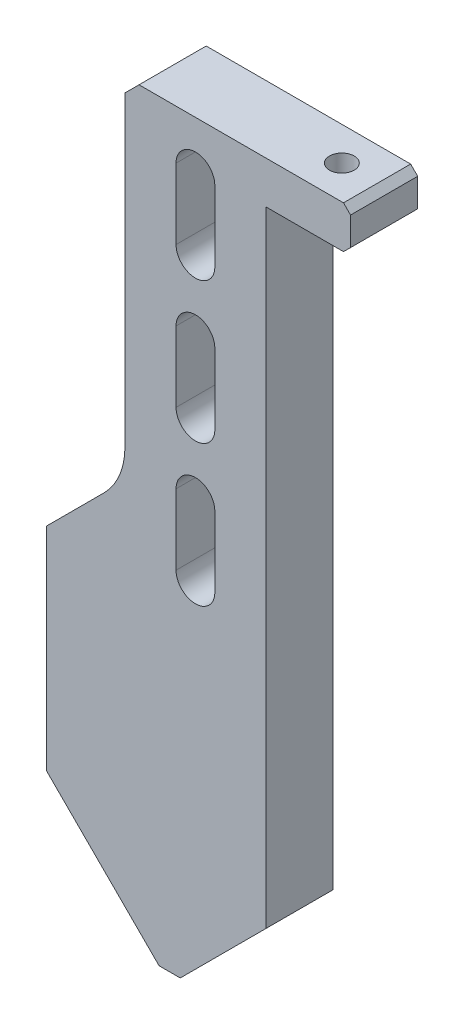
from build123d import *

# Parameters (mm, degrees)
BOSS_EXTRUDE1_DEPTH      = 4.7625
BOSS_EXTRUDE1_DEPTH_BACK = 4.7625
SKETCH2_R                = 1.75
CUT_EXTRUDE1_DEPTH       = 234.33333921
FILLET1_R                = 10
CHAMFER1_SIZE            = 2
CHAMFER2_SIZE            = 1


with BuildPart() as part:
    # Sketch1 → Boss-Extrude1 (new, two sides: drawn at the far end of the back side and taken through both)
    with BuildSketch(Plane.XY.offset(-BOSS_EXTRUDE1_DEPTH_BACK)):
        Polygon((-191.403805922, 11.396194078), (-207.403805922, 27.396194078), (-207.403805922, 57.396194078), (-196.247691321, 68.552308679), (-196.247691321, 118.192388155), (-164.247691321, 118.192388155), (-164.247691321, 112.192388155), (-176.247691321, 112.192388155), (-176.247691321, 23.552308679), (-188.403805922, 11.396194078), align=None)
        with BuildLine():
            Line((-183.497691321, 61.192388155), (-183.497691321, 71.192388155))
            ThreePointArc((-183.497691321, 71.192388155), (-186.247691321, 73.942388155), (-188.997691321, 71.192388155))
            Line((-188.997691321, 71.192388155), (-188.997691321, 61.192388155))
            ThreePointArc((-188.997691321, 61.192388155), (-186.247691321, 58.442388155), (-183.497691321, 61.192388155))
        make_face(mode=Mode.SUBTRACT)
        with BuildLine():
            Line((-183.497691321, 81.192388155), (-183.497691321, 91.192388155))
            ThreePointArc((-183.497691321, 91.192388155), (-186.247691321, 93.942388155), (-188.997691321, 91.192388155))
            Line((-188.997691321, 91.192388155), (-188.997691321, 81.192388155))
            ThreePointArc((-188.997691321, 81.192388155), (-186.247691321, 78.442388155), (-183.497691321, 81.192388155))
        make_face(mode=Mode.SUBTRACT)
        with BuildLine():
            Line((-183.497691321, 101.192388155), (-183.497691321, 111.192388155))
            ThreePointArc((-183.497691321, 111.192388155), (-186.247691321, 113.942388155), (-188.997691321, 111.192388155))
            Line((-188.997691321, 111.192388155), (-188.997691321, 101.192388155))
            ThreePointArc((-188.997691321, 101.192388155), (-186.247691321, 98.442388155), (-183.497691321, 101.192388155))
        make_face(mode=Mode.SUBTRACT)
    extrude(amount=BOSS_EXTRUDE1_DEPTH + BOSS_EXTRUDE1_DEPTH_BACK)

    # Sketch2 → Cut-Extrude1 (cut, through all)
    with BuildSketch(Plane(origin=(0, 118.192388155, 0), x_dir=(-1, 0, 0), z_dir=(0, 1, 0))):
        with Locations((170.247691321, 0)):
            Circle(SKETCH2_R)
    extrude(amount=-CUT_EXTRUDE1_DEPTH, mode=Mode.SUBTRACT)

    # Fillet1
    fillet1_edges = [part.edges().sort_by_distance(p)[0] for p in [
        (-196.247691321, 68.552308679, 0),
    ]]
    fillet(fillet1_edges, radius=FILLET1_R)

    # Chamfer1
    chamfer1_edges = [part.edges().sort_by_distance(p)[0] for p in [
        (-196.247691321, 118.192388155, 0),
    ]]
    chamfer(chamfer1_edges, length=CHAMFER1_SIZE)

    # Chamfer2
    chamfer2_edges = [part.edges().sort_by_distance(p)[0] for p in [
        (-164.247691321, 118.192388155, 0),
        (-164.247691321, 112.192388155, 0),
    ]]
    chamfer(chamfer2_edges, length=CHAMFER2_SIZE)


solid = part.part
